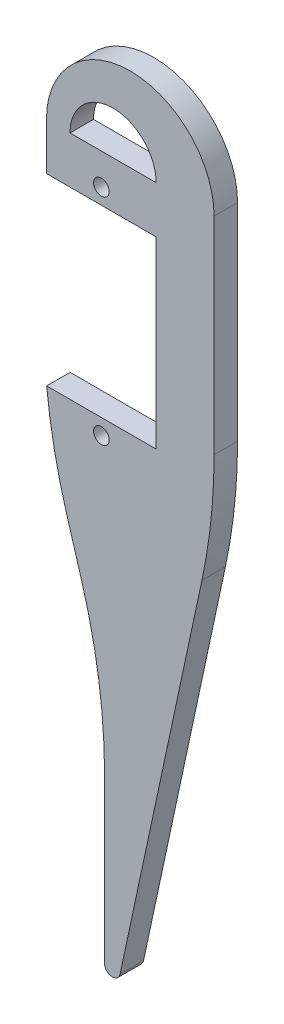
from build123d import *

# Parameters (mm, degrees)
SKETCH1_R           = 1
BOSS_EXTRUDE1_DEPTH = 3
FILLET_2_R          = 70


with BuildPart() as part:
    # Sketch1 → Boss-Extrude1 (new body)
    with BuildSketch(Plane.XY):
        with BuildLine():
            Line((-59.269719731, 24.533720681), (-59.269719731, 18.533720681))
            Line((-59.269719731, 18.533720681), (-45.247809755, 18.533720681))
            Line((-45.247809755, 18.533720681), (-45.247809755, -4.966279319))
            Line((-45.247809755, -4.966279319), (-59.247809755, -4.966279319))
            Line((-59.247809755, -4.966279319), (-59.247809755, -9.307077777))
            Line((-59.247809755, -9.307077777), (-51.83788451, -34.085396001))
            Line((-51.83788451, -34.085396001), (-51.83788451, -65.202303041))
            ThreePointArc((-51.83788451, -65.202303041), (-50.943230184, -66.196738704), (-49.860079932, -65.411822033))
            Line((-49.860079932, -65.411822033), (-37.838240661, -9.307077777))
            Line((-37.838240661, -9.307077777), (-37.838240661, 24.533720681))
            ThreePointArc((-37.838240661, 24.533720681), (-48.553980196, 35.249460216), (-59.269719731, 24.533720681))
        make_face()
        with Locations((-52.247809755, 20.533720681)):
            Circle(SKETCH1_R, mode=Mode.SUBTRACT)
        with Locations((-52.247809755, -6.966279319)):
            Circle(SKETCH1_R, mode=Mode.SUBTRACT)
        with BuildLine():
            Line((-45.247809755, 24.533720681), (-56.258764743, 24.533720681))
            ThreePointArc((-56.258764743, 24.533720681), (-50.753287249, 30.039198175), (-45.247809755, 24.533720681))
        make_face(mode=Mode.SUBTRACT)
    extrude(amount=BOSS_EXTRUDE1_DEPTH)

    # Скругление2
    # the kernel refuses this fillet: 70 mm, written as the material it adds along each edge
    with BuildSketch(Plane(origin=(-51.83788451, -34.085396001, 0), x_dir=(-0.28651166180092774, 0.9580767545724459, 0), z_dir=(0, 0, 1))) as fillet_2_piece_1:
        with BuildLine():
            CenterArc((FILLET_2_R * 0.146322998387, FILLET_2_R), FILLET_2_R, 253.350770917, 16.649229083)
            Line((-FILLET_2_R * 0.140188663414, FILLET_2_R * 0.0419232454276), (0, 0))
            Line((0, 0), (FILLET_2_R * 0.146322998387, 0))
        make_face()
    extrude(amount=3)
    # the kernel refuses this fillet: 70 mm, written as the material it takes off along each edge
    with BuildSketch(Plane(origin=(-59.247809755, -9.307077777, -22.444406255), x_dir=(0, 1, 0), z_dir=(0, 0, 1))) as fillet_2_2_piece_1:
        with BuildLine():
            CenterArc((11.454430765, -69.637606474), FILLET_2_R, 95.832656056, 10.816573027)
            Line((-8.601385561, -2.572233654), (0, 0))
            Line((0, 0), (4.340798458, 0))
        make_face()
    extrude(amount=47.88881251, mode=Mode.SUBTRACT)
    with BuildSketch(Plane(origin=(-37.838240661, -9.307077777, -18.538648377), x_dir=(0, 1, 0), z_dir=(0, 0, 1))) as fillet_2_2_piece_2:
        with BuildLine():
            CenterArc((FILLET_2_R * 0.10593513358, FILLET_2_R), FILLET_2_R, 257.905834548, 12.094165452)
            Line((-FILLET_2_R * 0.103583858541, FILLET_2_R * 0.0221954224179), (0, 0))
            Line((0, 0), (FILLET_2_R * 0.10593513358, 0))
        make_face()
    extrude(amount=40.077296753, mode=Mode.SUBTRACT)


solid = part.part
